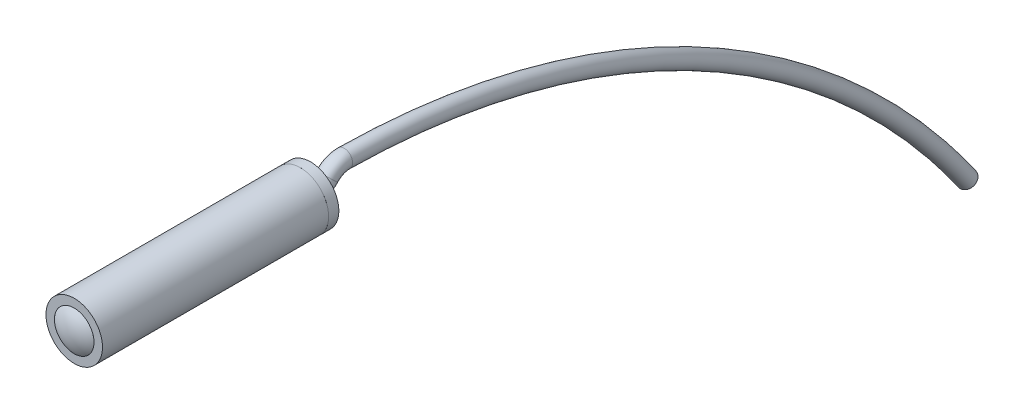
from build123d import *

# Parameters (mm, degrees)
SKETCH1_R             = 2.5
SKETCH1_R_2           = 1.75
EXTRUDE1_DEPTH        = 20
SKETCH4_W             = 0.6
SKETCH4_H             = 1.3
EXTRUDE2_DEPTH        = 1.1
SKETCH8_W             = 1
SKETCH8_H             = 1.4
SKETCH9_W             = 0.5
SKETCH9_H             = 1.75
SKETCH10_W            = 3.5
SKETCH10_H            = 1.75
SKETCH11_W            = 2.35
SKETCH11_H            = 0.35
SKETCH11_W_2          = 0.3
SKETCH11_H_2          = 0.3
SKETCH_2_W            = 0.6
SKETCH_2_H            = 0.1
SKETCH_3_W            = 0.05
SKETCH_3_H            = 0.46
SKETCH_4_W            = 0.2
SKETCH_4_H            = 0.36
SKETCH12_R            = 1.75
SKETCH12_W            = 2.2
SKETCH12_H            = 2.2
EXTRUDE3_DEPTH        = 0.2
SKETCH14_R            = 2.5
EXTRUDE4_DEPTH        = 0.9
SKETCH16_R            = 0.75
REVOLVE16_START       = 13.45
REVOLVE16_OUTLINE_R   = 1.75
REVOLVE16_OUTLINE_R_2 = 1.4
REVOLVE16_DEPTH       = 1


# Read off the part's stored shape, not the designer's step: Revolve12, Revolve16
with BuildPart() as part:
    # Sketch1 → Extrude1 (new body)
    with BuildSketch(Plane.XY):
        Circle(SKETCH1_R)
        Circle(SKETCH1_R_2, mode=Mode.SUBTRACT)
    extrude(amount=EXTRUDE1_DEPTH)


with BuildPart() as body_2:
    # Sketch2 → Revolve1 (revolve)
    with BuildSketch(Plane(origin=(0, 0, 0), x_dir=(0, 0, -1), z_dir=(1, 0, 0))):
        with BuildLine():
            ThreePointArc((-19.7, 0), (-19.568605761, 0.580947502), (-19.2, 1.048808848))
            Line((-19.2, 1.048808848), (-19.2, 1.75))
            Line((-19.2, 1.75), (-20, 1.75))
            ThreePointArc((-20, 1.75), (-20.419005859, 0.919212772), (-20.563301414, 0))
            Line((-20.563301414, 0), (-19.7, 0))
        make_face()
    revolve(axis=Axis((0, 0, 20.563301414), (0, 0, -1)))


with BuildPart() as body_3:
    # Sketch3 → Revolve2 (revolve)
    with BuildSketch(Plane(origin=(0, 0, 0), x_dir=(0, 0, -1), z_dir=(1, 0, 0))):
        with BuildLine():
            Line((-19, 1.4), (-19, 0))
            Line((-19, 0), (-18.78337521, 0))
            ThreePointArc((-18.78337521, 0), (-18.711820281, 0.714195616), (-18.5, 1.4))
            Line((-18.5, 1.4), (-19, 1.4))
        make_face()
        with BuildLine():
            Line((-19, 0), (-19, 1.4))
            ThreePointArc((-19, 1.4), (-19.073833338, 0.701729878), (-19.098484964, 0))
            Line((-19.098484964, 0), (-19, 0))
        make_face()
    revolve(axis=Axis((0, 0, 21.458372104), (0, 0, -1)))


with BuildPart() as body_4:
    # Sketch4 → Revolve3 (revolve)
    with BuildSketch(Plane(origin=(0, 0, 0), x_dir=(0, 0, -1), z_dir=(1, 0, 0)), mode=Mode.PRIVATE) as revolve3_sk:
        with Locations((-18.2, 0.65)):
            Rectangle(SKETCH4_W, SKETCH4_H)
    revolve(revolve3_sk.sketch.rotate(Axis((0, 0, 18.5), (0, 0, -1)), 180), axis=Axis((0, 0, 18.5), (0, 0, -1)))


with BuildPart() as body_5:
    # Sketch → Revolve4 (revolve)
    with BuildSketch(Plane(origin=(0, 0, 0), x_dir=(0, 0, -1), z_dir=(1, 0, 0))):
        with BuildLine():
            Line((-17.5, 0), (-17.5, 1.2))
            ThreePointArc((-17.5, 1.2), (-17.723863375, 0.618465844), (-17.8, 0))
            Line((-17.8, 0), (-17.5, 0))
        make_face()
        with BuildLine():
            Line((-17.5, 1.2), (-17.5, 0))
            Line((-17.5, 0), (-17.4, 0))
            ThreePointArc((-17.4, 0), (-17.336552813, 0.515388203), (-17.15, 1))
            Line((-17.15, 1), (-17.15, 1.2))
            Line((-17.15, 1.2), (-17.5, 1.2))
        make_face()
    revolve(axis=Axis((0, 0, 17.8), (0, 0, -1)))


with BuildPart() as body_6:
    # Sketch5 → Revolve5 (revolve)
    with BuildSketch(Plane(origin=(0, 0, 0), x_dir=(0, 0, -1), z_dir=(1, 0, 0))):
        with BuildLine():
            ThreePointArc((-15.65, 0.8), (-15.542574092, 0.406394211), (-15.506385865, 0))
            Line((-15.506385865, 0), (-15.15, 0))
            Line((-15.15, 0), (-15.15, 1))
            Line((-15.15, 1), (-15.65, 1))
            Line((-15.65, 1), (-15.65, 0.8))
        make_face()
        with BuildLine():
            ThreePointArc((-15.15, 1), (-15.033117971, 0.506059474), (-14.993843786, 0))
            Line((-14.993843786, 0), (-15.15, 0))
            Line((-15.15, 0), (-15.15, 1))
        make_face()
    revolve(axis=Axis((0, 0, 0), (0, 0, 1)))


with BuildPart() as body_7:
    # Sketch6 → Extrude2 (new, symmetric)
    with BuildSketch(Plane(origin=(0, 0, 0), x_dir=(0, 0, -1), z_dir=(1, 0, 0))):
        with BuildLine():
            Line((-14.95, 1.1), (-14.45, 1.1))
            Line((-14.45, 1.1), (-14.45, -1.1))
            Line((-14.45, -1.1), (-14.95, -1.1))
            Line((-14.95, -1.1), (-14.95, -0.9))
            ThreePointArc((-14.95, -0.9), (-14.854759208, 0), (-14.95, 0.9))
            Line((-14.95, 0.9), (-14.95, 1.1))
        make_face()
    extrude(amount=EXTRUDE2_DEPTH, both=True)

    # Sketch7 → Cut-Revolve1 (revolve, cut)
    with BuildSketch(Plane(origin=(0, 0, 0), x_dir=(0, 0, -1), z_dir=(1, 0, 0))):
        with BuildLine():
            Line((-14.63, 0), (-14.45, 0))
            Line((-14.45, 0), (-14.45, 0.9))
            ThreePointArc((-14.45, 0.9), (-14.584558781, 0.458911756), (-14.63, 0))
        make_face()
    revolve(axis=Axis((0, 0, 15.752226789), (0, 0, -1)), mode=Mode.SUBTRACT)

    # Sketch8 → Revolve7 (revolve)
    with BuildSketch(Plane(origin=(0, 0, 0), x_dir=(0, 0, -1), z_dir=(1, 0, 0)), mode=Mode.PRIVATE) as revolve7_sk:
        with Locations((-13.95, 0.7)):
            Rectangle(SKETCH8_W, SKETCH8_H)
        with BuildLine():
            ThreePointArc((-13.45, 1.4), (-13.1583491, 0.726830776), (-13.058679276, 0))
            Line((-13.058679276, 0), (-13.45, 0))
            Line((-13.45, 0), (-13.45, 1.4))
        make_face()
    revolve(revolve7_sk.sketch.rotate(Axis((0, 0, 14.45), (0, 0, -1)), 180), axis=Axis((0, 0, 14.45), (0, 0, -1)))


with BuildPart() as body_8:
    # Sketch9 → Revolve8 (revolve)
    with BuildSketch(Plane(origin=(0, 0, 0), x_dir=(0, 0, -1), z_dir=(1, 0, 0))):
        with Locations((-12.536901068, 0.875)):
            Rectangle(SKETCH9_W, SKETCH9_H)
        with BuildLine():
            ThreePointArc((-12.286901068, 1.75), (-11.937249589, 0.905866658), (-11.817989981, 0))
            Line((-11.817989981, 0), (-12.286901068, 0))
            Line((-12.286901068, 0), (-12.286901068, 1.75))
        make_face()
        with BuildLine():
            Line((-12.786901068, 0), (-12.786901068, 1.75))
            ThreePointArc((-12.786901068, 1.75), (-12.915631775, 0.879205288), (-12.958679276, 0))
            Line((-12.958679276, 0), (-12.786901068, 0))
        make_face()
    revolve(axis=Axis((0, 0, 0), (0, 0, 1)))


with BuildPart() as body_9:
    # Sketch10 → Revolve9 (revolve)
    with BuildSketch(Plane(origin=(0, 0, 0), x_dir=(0, 0, -1), z_dir=(1, 0, 0)), mode=Mode.PRIVATE) as revolve9_sk:
        with Locations((-9.767989981, 0.875)):
            Rectangle(SKETCH10_W, SKETCH10_H)
    revolve(revolve9_sk.sketch.rotate(Axis((0, 0, 11.503678327), (0, 0, -1)), 180), axis=Axis((0, 0, 11.503678327), (0, 0, -1)))


with BuildPart() as body_10:
    # Sketch11 → Revolve10 (revolve)
    with BuildSketch(Plane(origin=(0, 0, 0), x_dir=(0, 0, -1), z_dir=(1, 0, 0))):
        with Locations((-18.025, 1.575)):
            Rectangle(SKETCH11_W, SKETCH11_H)
        with Locations((-17, 1.25)):
            Rectangle(SKETCH11_W_2, SKETCH11_H_2)
    revolve(axis=Axis((0, 0, 17.84770268), (0, 0, 1)))


with BuildPart() as body_11:
    # Sketch 2 → Revolve11 (revolve)
    with BuildSketch(Plane(origin=(0, 0, 0), x_dir=(0, 0, -1), z_dir=(1, 0, 0)), mode=Mode.PRIVATE) as revolve11_sk:
        with Locations((-18.2, 1.35)):
            Rectangle(SKETCH_2_W, SKETCH_2_H)
        with BuildLine():
            Line((-17.5, 1.2), (-17.5, 1.4))
            Line((-17.5, 1.4), (-17.9, 1.4))
            Line((-17.9, 1.4), (-17.9, 1.3))
            Line((-17.9, 1.3), (-17.9, 1.25))
            Line((-17.9, 1.25), (-17.550543414, 1.1))
            ThreePointArc((-17.550543414, 1.1), (-17.525821026, 1.150277644), (-17.5, 1.2))
        make_face()
    revolve(revolve11_sk.sketch.rotate(Axis((0, 0, 17.9), (0, 0, 1)), 90), axis=Axis((0, 0, 17.9), (0, 0, 1)))


with BuildPart() as body_12:
    # Revolve12 outline → Revolve12 (revolve)
    with BuildSketch(Plane.XZ):
        with BuildLine():
            ThreePointArc((1.29999999, 19.013624904), (1.350017189, 19.006938607), (1.40000001, 18.999999999))
            Line((1.40000001, 18.999999999), (1.4, 19.2))
            Line((1.4, 19.2), (1.3, 19.2))
            Line((1.3, 19.2), (1.29999999, 19.013624904))
        make_face()
    revolve(axis=Axis((0, 0, 0), (0, 0, 1)))


with BuildPart() as body_13:
    # Sketch 3 → Revolve13 (revolve)
    with BuildSketch(Plane(origin=(0, 0, 0), x_dir=(0, 0, -1), z_dir=(1, 0, 0))):
        Polygon((-14.65, 1.75), (-16.85, 1.75), (-16.85, 1.4), (-15.7, 1.4), (-15.65, 1.4), (-15.15, 1.4), (-14.95, 1.4), (-14.65, 1.4), align=None)
        with Locations((-15.675, 1.17)):
            Rectangle(SKETCH_3_W, SKETCH_3_H)
    revolve(axis=Axis((0, 0, 16.031651862), (0, 0, 1)))


with BuildPart() as body_14:
    # Sketch 4 → Revolve14 (revolve)
    with BuildSketch(Plane(origin=(0, 0, 0), x_dir=(0, 0, -1), z_dir=(1, 0, 0))):
        with Locations((-15.05, 1.22)):
            Rectangle(SKETCH_4_W, SKETCH_4_H)
    revolve(axis=Axis((0, 0, 14.029611912), (0, 0, 1)))


with BuildPart() as body_15:
    # Sketch12 → Extrude3 (new body)
    with BuildSketch(Plane.XY.offset(14.45)):
        Circle(SKETCH12_R)
        Rectangle(SKETCH12_W, SKETCH12_H, mode=Mode.SUBTRACT)
    extrude(amount=EXTRUDE3_DEPTH)


with BuildPart() as body_16:
    # Sketch13 → Revolve15 (revolve)
    with BuildSketch(Plane(origin=(0, 0, 0), x_dir=(0, 0, -1), z_dir=(1, 0, 0))):
        with BuildLine():
            Line((-13.45, 1.75), (-12.798583122, 1.75))
            Line((-12.798583122, 1.75), (-12.786901068, 1.75))
            ThreePointArc((-12.786901068, 1.75), (-12.794732698, 1.710017522), (-12.802383251, 1.67))
            Line((-12.802383251, 1.67), (-13.45, 1.67))
            Line((-13.45, 1.67), (-13.45, 1.75))
        make_face()
        with BuildLine():
            Line((-12.253042999, 1.75), (-11.517989981, 1.75))
            Line((-11.517989981, 1.75), (-11.517989981, 1.67))
            Line((-11.517989981, 1.67), (-12.242099866, 1.67))
            ThreePointArc((-12.242099866, 1.67), (-12.264238483, 1.710146715), (-12.286901068, 1.75))
            Line((-12.286901068, 1.75), (-12.253042999, 1.75))
        make_face()
    revolve(axis=Axis((0, 0, 13.863335633), (0, 0, 1)))


with BuildPart() as body_17:
    # Sketch14 → Extrude4 (new body)
    with BuildSketch(Plane(origin=(0, 0, 0), x_dir=(-1, 0, 0), z_dir=(0, 0, -1))):
        Circle(SKETCH14_R)
    extrude(amount=EXTRUDE4_DEPTH)

    # Sweep2: sweep along a path in Sketch15
    with BuildLine(Plane(origin=(0, 0, 0), x_dir=(0, 0, -1), z_dir=(1, 0, 0))) as sweep2_path:
        ThreePointArc((0.9, 0), (1.704548986, 0.168961789), (2.373159935, 0.64729907))
        ThreePointArc((2.373159935, 0.64729907), (3.053474118, 1.130734196), (3.871849882, 1.294435189))
        ThreePointArc((3.871849882, 1.294435189), (34.932424284, -6.624423155), (58.959707155, -27.841333333))
    # Sketch16 → Sweep2 (sweep)
    with BuildSketch(Plane(origin=(0, 0, -0.9), x_dir=(-1, 0, 0), z_dir=(0, 0, -1))):
        Circle(SKETCH16_R)
    sweep(path=sweep2_path.line)


with BuildPart() as body_18:
    # Revolve16 outline → Revolve16 (new body)
    with BuildSketch(Plane.XY.offset(REVOLVE16_START)):
        Circle(REVOLVE16_OUTLINE_R)
        Circle(REVOLVE16_OUTLINE_R_2, mode=Mode.SUBTRACT)
    extrude(amount=REVOLVE16_DEPTH)


solid = Compound([part.part, body_2.part, body_3.part, body_4.part, body_5.part, body_6.part, body_7.part, body_8.part, body_9.part, body_10.part, body_11.part, body_12.part, body_13.part, body_14.part, body_15.part, body_16.part, body_17.part, body_18.part])
